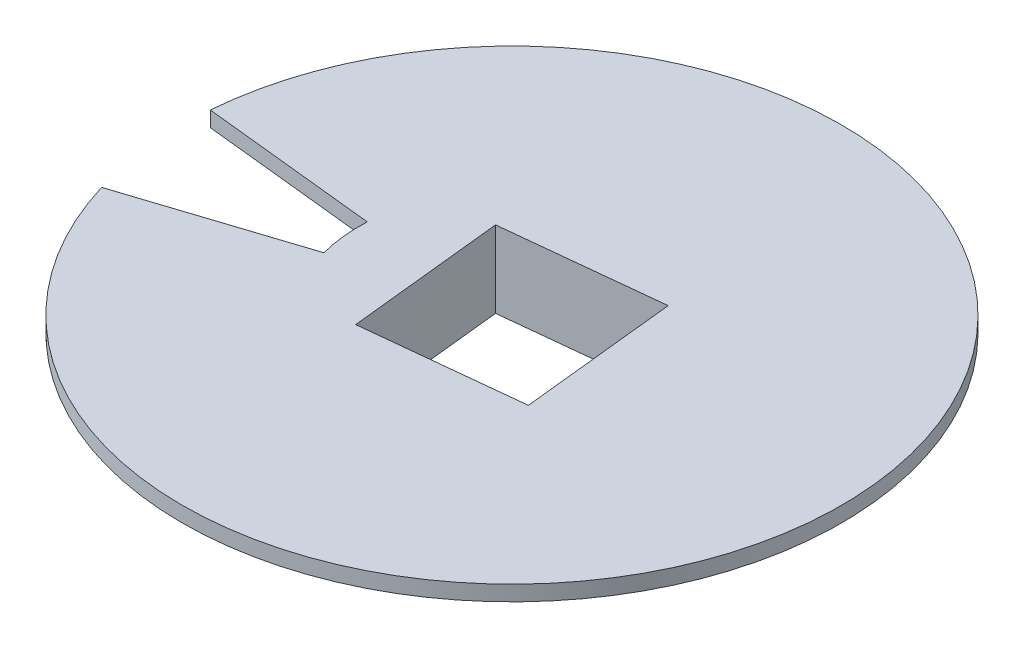
from build123d import *

# Parameters (mm, degrees)
SKETCH7_W               = 86
SKETCH7_H               = 4
CUT_EXTRUDE3_DEPTH      = 122.688125961
CUT_EXTRUDE3_DEPTH_BACK = 122.688125961
SKETCH9_R               = 40
CUT_EXTRUDE4_DEPTH      = 122.688125961
SKETCH10_R              = 40
BOSS_EXTRUDE1_DEPTH     = 20
CUT_EXTRUDE7_DEPTH      = 124.255831505


with BuildPart() as part:
    # Sketch7 → Revolve4 (revolve)
    with BuildSketch(Plane.XY):
        with Locations((-43, -2)):
            Rectangle(SKETCH7_W, SKETCH7_H)
    revolve(axis=Axis((0, 0, 0), (0, -1, 0)))

    # Sketch9 → Cut-Extrude3 (cut, two sides: drawn at the far end of the back side and taken through both)
    with BuildSketch(Plane(origin=(0, 0, 0), x_dir=(1, 0, 0), z_dir=(0, 1, 0)).offset(-CUT_EXTRUDE3_DEPTH_BACK)):
        Circle(SKETCH9_R)
    extrude(amount=CUT_EXTRUDE3_DEPTH + CUT_EXTRUDE3_DEPTH_BACK, mode=Mode.SUBTRACT)

    # Sketch1 → Cut-Extrude4 (cut, through all)
    with BuildSketch(Plane(origin=(0, 0, 0), x_dir=(1, 0, 0), z_dir=(0, 1, 0))):
        with BuildLine():
            Line((-86.191983256, -25.902548569), (-9.566772234, -1.00550828))
            Line((-9.566772234, -1.00550828), (-89.693924294, 7.416194762))
            ThreePointArc((-89.693924294, 7.416194762), (-89.506970583, -9.407561694), (-86.191983256, -25.902548569))
        make_face()
    extrude(amount=-CUT_EXTRUDE4_DEPTH, mode=Mode.SUBTRACT)

    # Sketch10 → Boss-Extrude1 (add)
    with BuildSketch(Plane(origin=(0, 0, 0), x_dir=(-1, 0, 0), z_dir=(0, -1, 0))):
        Circle(SKETCH10_R)
    extrude(amount=BOSS_EXTRUDE1_DEPTH)

    # Sketch14 → Cut-Extrude7 (cut, through all)
    with BuildSketch(Plane(origin=(0, 0, 0), x_dir=(1, 0, 0), z_dir=(0, 1, 0))):
        Polygon((22.530532352, -18.244865358), (18.244865358, 22.530532352), (-22.530532352, 18.244865358), (-18.244865358, -22.530532352), align=None)
    extrude(amount=-CUT_EXTRUDE7_DEPTH, mode=Mode.SUBTRACT)


solid = part.part
